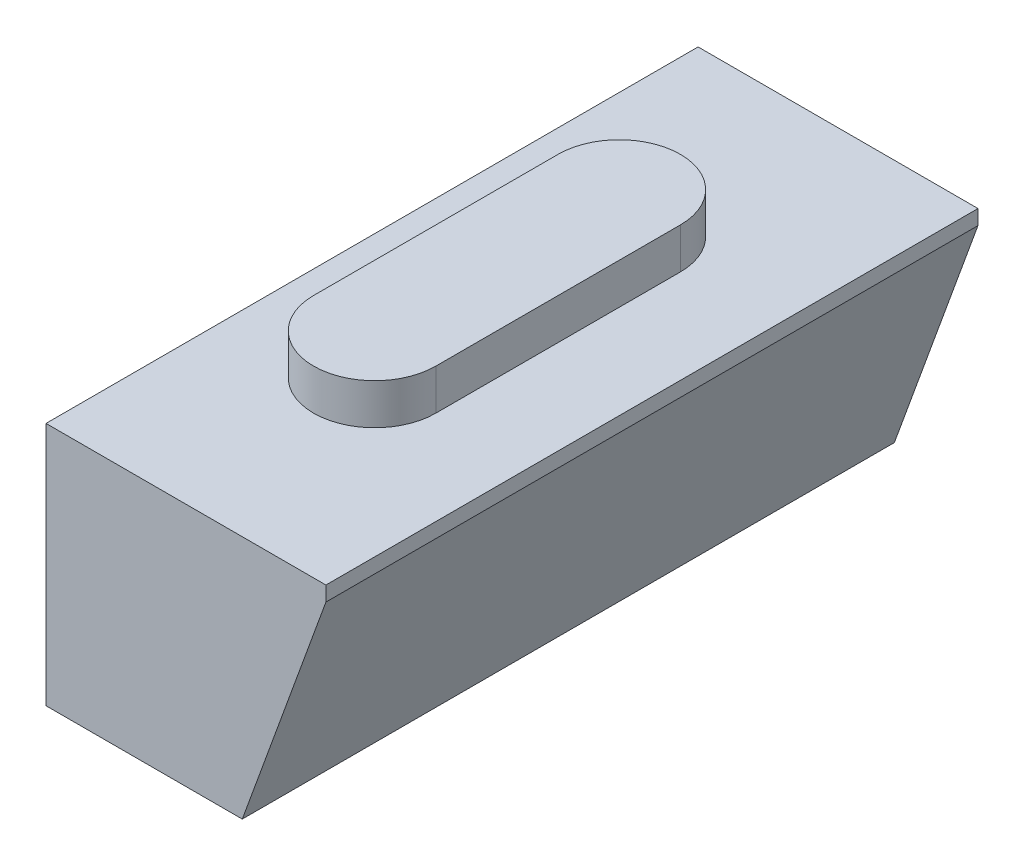
from build123d import *

# Parameters (mm, degrees)
BOSS_EXTRUDE1_DEPTH = 160
BOSS_EXTRUDE2_START = 60
BOSS_EXTRUDE2_DEPTH = 10
SKETCH4_W           = 2.23742312
SKETCH4_H           = 10.231207741
CUT_EXTRUDE1_DEPTH  = 175


# Read off the part's stored shape, not the designer's step: Boss-Extrude2
with BuildPart() as part:
    # Sketch1 → Boss-Extrude1 (new body)
    with BuildSketch(Plane.XY):
        Polygon((0, 0), (0, 60), (70, 60), (48.161785944, 0), align=None)
    extrude(amount=BOSS_EXTRUDE1_DEPTH)

    # Boss-Extrude2 outline → Boss-Extrude2 (add)
    with BuildSketch(Plane(origin=(0, 0, 0), x_dir=(1, 0, 0), z_dir=(0, 1, 0)).offset(BOSS_EXTRUDE2_START)):
        with BuildLine():
            ThreePointArc((45.65, -50), (30.65, -35), (15.65, -50))
            Line((15.65, -50), (15.65, -110))
            ThreePointArc((15.65, -110), (30.65, -125), (45.65, -110))
            Line((45.65, -110), (45.65, -50))
        make_face()
    extrude(amount=BOSS_EXTRUDE2_DEPTH)

    # Sketch4 → Cut-Extrude1 (cut)
    with BuildSketch(Plane.XY.offset(160)):
        with Locations((69.79871156, 58.529652548)):
            Rectangle(SKETCH4_W, SKETCH4_H)
    extrude(amount=-CUT_EXTRUDE1_DEPTH, mode=Mode.SUBTRACT)


solid = part.part
